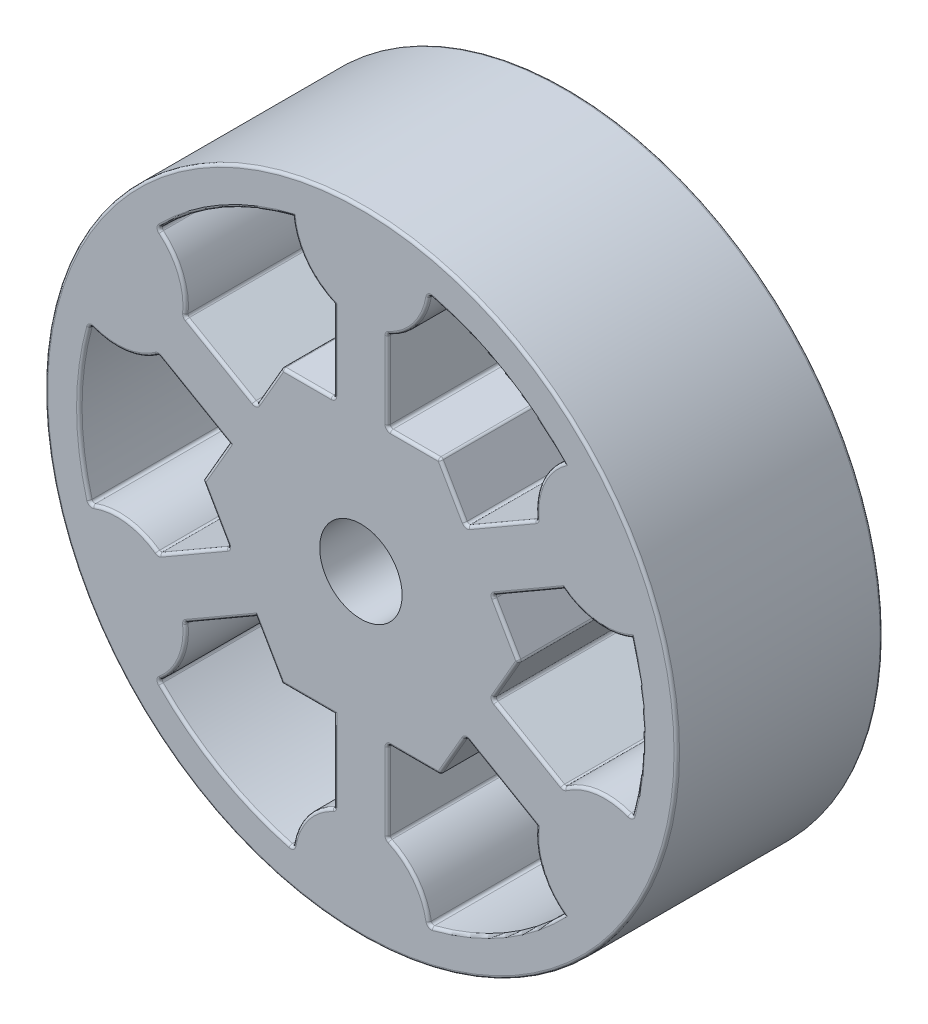
from build123d import *

# Parameters (mm, degrees)
SKETCH1_R           = 23.000000000000004
SKETCH1_R_2         = 3
BOSS_EXTRUDE1_DEPTH = 7.5
FILLET1_R           = 0.2


with BuildPart() as part:
    # Sketch1 → Boss-Extrude1 (new, symmetric)
    with BuildSketch(Plane.XY):
        Circle(SKETCH1_R)
        with BuildLine():
            Line((-7.646881939717565, -6.673796247970455), (-5.750000000000046, -9.959292143521019))
            Line((-5.749999999999906, -9.959292143521095), (-1.9562361205650616, -9.95929214352103))
            Line((-1.9562361205650616, -9.95929214352103), (-1.9562361205651022, -15.898571934649313))
            ThreePointArc((-1.9562361205651022, -15.898571934649315), (-3.993896967911092, -17.491879821265158), (-4.96268047545767, -19.890243902438986))
            ThreePointArc((-4.96268047545767, -19.89024390243899), (-10.250000000000146, -17.75352077758091), (-14.744116269252089, -14.24292931383063))
            ThreePointArc((-14.744116269252089, -14.242929313830633), (-13.15146380120467, -12.204756144941022), (-12.790449119018218, -9.643436143534547))
            Line((-12.790449119018218, -9.643436143534547), (-7.646881939717565, -6.673796247970455))
        make_face(mode=Mode.SUBTRACT)
        with BuildLine():
            Line((1.9562361205649244, -9.959292143521058), (5.749999999999975, -9.959292143521058))
            Line((5.750000000000115, -9.959292143520976), (7.646881939717474, -6.673796247970562))
            Line((7.646881939717474, -6.673796247970563), (12.79044911901809, -9.643436143534727))
            ThreePointArc((12.79044911901809, -9.643436143534727), (13.15146380120452, -12.204756144941202), (14.744116269251892, -14.242929313830842))
            ThreePointArc((14.744116269251895, -14.242929313830846), (10.2499999999999, -17.753520777581063), (4.962680475457393, -19.89024390243906))
            ThreePointArc((4.962680475457394, -19.890243902439057), (3.993896967910864, -17.491879821265204), (1.9562361205648848, -15.898571934649341))
            Line((1.9562361205648833, -15.898571934649341), (1.9562361205649244, -9.959292143521058))
        make_face(mode=Mode.SUBTRACT)
        with BuildLine():
            Line((9.603118060282483, -3.2854958955505658), (11.499999999999996, -2.66e-15))
            Line((11.5, 0), (9.603118060282505, 3.2854958955504987))
            Line((9.603118060282505, 3.2854958955504987), (14.746685239583137, 6.25513579111463))
            ThreePointArc((14.746685239583137, 6.255135791114629), (17.145360769115555, 5.2871236763240095), (19.7067967447095, 5.647314588608207))
            ThreePointArc((19.7067967447095, 5.647314588608209), (20.500000000000007, -7.105e-14), (19.706796744709465, -5.647314588608345))
            ThreePointArc((19.706796744709468, -5.647314588608344), (17.145360769115523, -5.287123676324112), (14.746685239583098, -6.255135791114732))
            Line((14.746685239583098, -6.255135791114731), (9.603118060282483, -3.2854958955505658))
        make_face(mode=Mode.SUBTRACT)
        with BuildLine():
            Line((-9.60311806028246, 3.2854958955506297), (-11.5, 7.816e-14))
            Line((-11.499999999999998, -8.03e-14), (-9.603118060282526, -3.2854958955504325))
            Line((-9.603118060282526, -3.2854958955504325), (-14.746685239583181, -6.255135791114527))
            ThreePointArc((-14.746685239583183, -6.255135791114528), (-17.145360769115594, -5.2871236763238905), (-19.706796744709543, -5.647314588608069))
            ThreePointArc((-19.706796744709546, -5.647314588608069), (-20.500000000000007, 2.1516e-13), (-19.706796744709425, 5.647314588608481))
            ThreePointArc((-19.706796744709425, 5.647314588608481), (-17.145360769115484, 5.287123676324228), (-14.746685239583053, 6.25513579111483))
            Line((-14.746685239583053, 6.2551357911148315), (-9.60311806028246, 3.2854958955506293))
        make_face(mode=Mode.SUBTRACT)
        with BuildLine():
            ThreePointArc((-4.9626804754575335, 19.89024390243902), (-3.9938969679109846, 17.49187982126518), (-1.956236120564995, 15.898571934649327))
            Line((-1.9562361205649943, 15.898571934649327), (-1.9562361205649939, 9.959292143521044))
            Line((-1.9562361205649939, 9.959292143521044), (-5.749999999999907, 9.959292143521095))
            Line((-5.750000000000044, 9.959292143521019), (-7.646881939717427, 6.6737962479706106))
            Line((-7.646881939717427, 6.6737962479706106), (-12.790449119018021, 9.643436143534812))
            ThreePointArc((-12.790449119018021, 9.643436143534812), (-13.151463801204432, 12.204756144941289), (-14.744116269251792, 14.242929313830942))
            ThreePointArc((-14.744116269251792, 14.24292931383094), (-10.249999999999897, 17.753520777581052), (-4.962680475457532, 19.890243902439025))
        make_face(mode=Mode.SUBTRACT)
        Circle(SKETCH1_R_2, mode=Mode.SUBTRACT)
        with BuildLine():
            Line((7.6468819397175185, 6.673796247970507), (5.750000000000115, 9.959292143520976))
            Line((5.749999999999977, 9.959292143521058), (1.9562361205649923, 9.959292143521044))
            Line((1.956236120564992, 9.959292143521044), (1.9562361205649912, 15.898571934649327))
            ThreePointArc((1.9562361205649919, 15.898571934649325), (3.9938969679109686, 17.491879821265186), (4.962680475457533, 19.89024390243902))
            ThreePointArc((4.96268047545753, 19.89024390243902), (10.250000000000023, 17.753520777580984), (14.74411626925199, 14.242929313830736))
            ThreePointArc((14.744116269251988, 14.242929313830738), (13.151463801204585, 12.204756144941115), (12.790449119018154, 9.64343614353464))
            Line((12.790449119018154, 9.643436143534638), (7.6468819397175185, 6.673796247970507))
        make_face(mode=Mode.SUBTRACT)
    extrude(amount=BOSS_EXTRUDE1_DEPTH, both=True)

    # Fillet1
    fillet1_edges = [part.edges().sort_by_distance(p)[0] for p in [
        (-12.174901649932757, 4.77031584333273, -7.5),
        (-10.551559030141261, -1.6427479477752565, -7.5),
        (-10.218665529367891, -8.1586161957525, -7.5),
        (-1.956236120565082, -12.928932039085172, -7.5),
        (3.8531180602824495, -9.959292143521058, -7.5),
        (10.218665529367783, -8.158616195752645, -7.5),
        (20.500000000000007, -7.15e-14, -7.5),
        (12.17490164993282, 4.770315843332565, -7.5),
        (13.151463801204585, 12.204756144941117, -7.5),
        (10.250000000000023, 17.753520777580988, -7.5),
        (-6.698440969858735, 8.316544195745815, -7.5),
        (-1.956236120564994, 12.928932039085186, -7.5),
        (-20.500000000000007, 2.1716e-13, -7.5),
        (-17.145360769115484, 5.287123676324228, -7.5),
        (-12.174901649932853, -4.7703158433324795, -7.5),
        (-17.145360769115594, -5.2871236763238905, -7.5),
        (-10.250000000000146, -17.753520777580906, -7.5),
        (-13.15146380120467, -12.204756144941022, -7.5),
        (-3.993896967911092, -17.491879821265158, -7.5),
        (10.249999999999904, -17.753520777581066, -7.5),
        (3.9938969679108642, -17.491879821265208, -7.5),
        (1.956236120564904, -12.9289320390852, -7.5),
        (6.698440969858794, -8.316544195745768, -7.5),
        (17.14536076911552, -5.2871236763241125, -7.5),
        (12.17490164993279, -4.770315843332648, -7.5),
        (10.55155903014124, -1.6427479477752842, -7.5),
        (10.551559030141252, 1.6427479477752494, -7.5),
        (-23.000000000000004, 2.82e-15, -7.5),
        (10.218665529367836, 8.158616195752572, -7.5),
        (6.698440969858817, 8.316544195745742, -7.5),
        (3.8531180602824846, 9.95929214352105, -7.5),
        (1.9562361205649916, 12.928932039085186, -7.5),
        (3.993896967910969, 17.491879821265186, -7.5),
        (-10.218665529367724, 8.15861619575271, -7.5),
        (-13.151463801204432, 12.204756144941289, -7.5),
        (-10.249999999999902, 17.75352077758106, -7.5),
        (-3.8531180602824504, 9.959292143521068, -7.5),
        (-20.500000000000007, 2.1716e-13, 7.5),
        (-17.145360769115484, 5.287123676324228, 7.5),
        (-12.174901649932757, 4.77031584333273, 7.5),
        (-10.551559030141231, 1.642747947775354, 7.5),
        (-10.551559030141261, -1.6427479477752565, 7.5),
        (-12.174901649932853, -4.7703158433324795, 7.5),
        (-17.145360769115594, -5.2871236763238905, 7.5),
        (-10.250000000000146, -17.753520777580906, 7.5),
        (-13.15146380120467, -12.204756144941022, 7.5),
        (-10.218665529367891, -8.1586161957525, 7.5),
        (-6.698440969858805, -8.316544195745736, 7.5),
        (-3.8531180602824837, -9.959292143521061, 7.5),
        (-1.956236120565082, -12.928932039085172, 7.5),
        (-3.993896967911092, -17.491879821265158, 7.5),
        (10.249999999999904, -17.753520777581066, 7.5),
        (3.9938969679108642, -17.491879821265208, 7.5),
        (1.956236120564904, -12.9289320390852, 7.5),
        (3.8531180602824495, -9.959292143521058, 7.5),
        (6.698440969858794, -8.316544195745768, 7.5),
        (10.218665529367783, -8.158616195752645, 7.5),
        (13.151463801204518, -12.2047561449412, 7.5),
        (20.500000000000007, -7.15e-14, 7.5),
        (17.14536076911552, -5.2871236763241125, 7.5),
        (12.17490164993279, -4.770315843332648, 7.5),
        (10.55155903014124, -1.6427479477752842, 7.5),
        (10.551559030141252, 1.6427479477752494, 7.5),
        (12.17490164993282, 4.770315843332565, 7.5),
        (17.145360769115555, 5.2871236763240095, 7.5),
        (-23.000000000000004, 2.82e-15, 7.5),
        (10.250000000000023, 17.753520777580988, 7.5),
        (13.151463801204585, 12.204756144941117, 7.5),
        (10.218665529367836, 8.158616195752572, 7.5),
        (6.698440969858817, 8.316544195745742, 7.5),
        (3.8531180602824846, 9.95929214352105, 7.5),
        (1.9562361205649916, 12.928932039085186, 7.5),
        (3.993896967910969, 17.491879821265186, 7.5),
        (-10.218665529367724, 8.15861619575271, 7.5),
        (-13.151463801204432, 12.204756144941289, 7.5),
        (-10.249999999999902, 17.75352077758106, 7.5),
        (-3.993896967910983, 17.49187982126518, 7.5),
        (-1.956236120564994, 12.928932039085186, 7.5),
        (-3.8531180602824504, 9.959292143521068, 7.5),
        (-6.698440969858735, 8.316544195745815, 7.5),
        (-19.706796744709543, -5.647314588608069, 0),
        (-14.746685239583183, -6.255135791114528, 0),
        (-9.603118060282526, -3.2854958955504325, 0),
        (-14.746685239583055, 6.2551357911148315, 0),
        (-19.706796744709422, 5.647314588608482, 0),
        (-4.96268047545767, -19.89024390243899, 0),
        (-1.956236120565102, -15.898571934649315, 0),
        (-12.790449119018218, -9.643436143534547, 0),
        (-14.744116269252089, -14.242929313830631, 0),
        (7.646881939717474, -6.673796247970563, 0),
        (5.750000000000044, -9.959292143521017, 0),
        (1.9562361205649244, -9.959292143521058, 0),
        (1.9562361205648844, -15.898571934649341, 0),
        (4.962680475457393, -19.89024390243906, 0),
        (9.603118060282505, 3.2854958955504987, 0),
        (11.499999999999998, -1.33e-15, 0),
        (9.603118060282483, -3.2854958955505658, 0),
        (14.746685239583098, -6.255135791114732, 0),
        (19.706796744709465, -5.647314588608346, 0),
        (4.962680475457532, 19.890243902439018, 0),
        (1.9562361205649914, 15.898571934649325, 0),
        (1.9562361205649923, 9.959292143521044, 0),
        (5.750000000000046, 9.959292143521017, 0),
        (7.6468819397175185, 6.673796247970507, 0),
        (12.790449119018152, 9.64343614353464, 0),
        (-7.646881939717427, 6.6737962479706106, 0),
        (-5.749999999999975, 9.959292143521058, 0),
        (-1.9562361205649939, 9.959292143521044, 0),
        (-14.744116269251794, 14.242929313830942, 0),
        (-12.790449119018021, 9.643436143534812, 0),
    ]]
    fillet(fillet1_edges, radius=FILLET1_R)


solid = part.part
